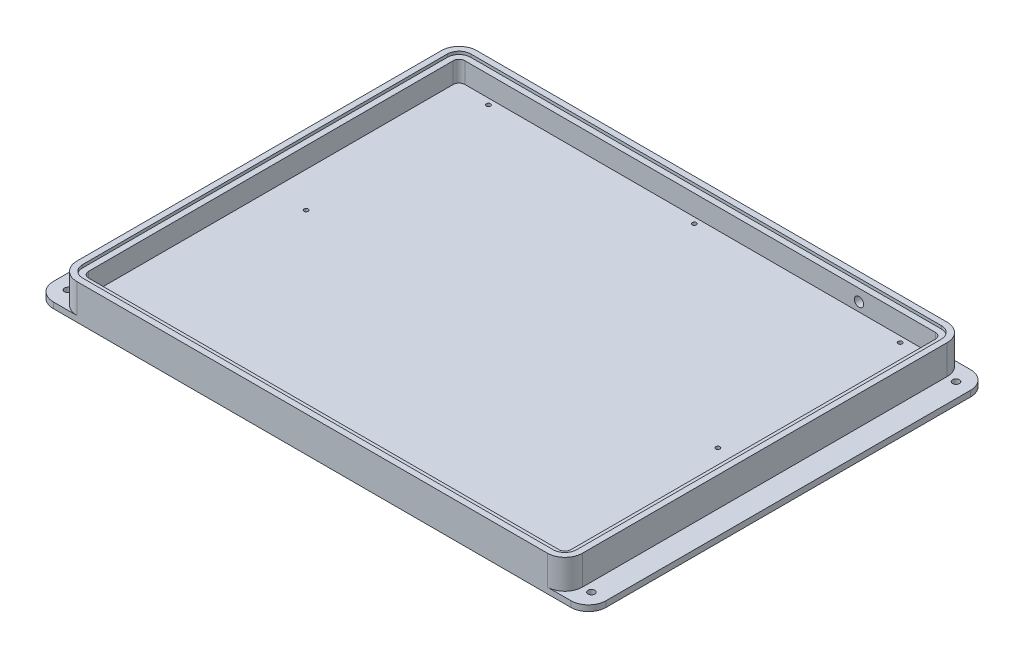
from build123d import *

# Parameters (mm, degrees)
SKETCH1_W           = 273.05
SKETCH1_H           = 215.9
BOSS_EXTRUDE1_DEPTH = 19.05
FILLET1_R           = 9.525
CUT_EXTRUDE1_DEPTH  = 12.7
CUT_EXTRUDE2_DEPTH  = 1.5875
SKETCH5_R           = 1.1303
CUT_EXTRUDE3_DEPTH  = 4.7625
SKETCH6_R           = 2.5
CUT_EXTRUDE4_DEPTH  = 12.7
BOSS_EXTRUDE2_DEPTH = 3.175
SKETCH8_R           = 1.8288
CUT_EXTRUDE5_DEPTH  = 359.493916441


with BuildPart() as part:
    # Sketch1 → Boss-Extrude1 (new body)
    with BuildSketch(Plane(origin=(0, 0, 0), x_dir=(1, 0, 0), z_dir=(0, 1, 0))):
        with Locations((136.525, 107.95)):
            Rectangle(SKETCH1_W, SKETCH1_H)
    extrude(amount=BOSS_EXTRUDE1_DEPTH)

    # Fillet1
    fillet1_edges = [part.edges().sort_by_distance(p)[0] for p in [
        (273.05, 9.525, 0),
        (273.05, 9.525, -215.9),
        (0, 9.525, 0),
        (0, 9.525, -215.9),
    ]]
    fillet(fillet1_edges, radius=FILLET1_R)

    # Sketch3 → Cut-Extrude1 (cut)
    with BuildSketch(Plane(origin=(0, 19.05, 0), x_dir=(1, 0, 0), z_dir=(0, 1, 0))):
        with BuildLine():
            Line((266.7, 9.525), (266.7, 206.375))
            ThreePointArc((266.7, 206.375), (265.77006403, 208.62006403), (263.525, 209.55))
            Line((263.525, 209.55), (9.525, 209.55))
            ThreePointArc((9.525, 209.55), (7.27993597, 208.62006403), (6.35, 206.375))
            Line((6.35, 206.375), (6.35, 9.525))
            ThreePointArc((6.35, 9.525), (7.27993597, 7.27993597), (9.525, 6.35))
            Line((9.525, 6.35), (263.525, 6.35))
            ThreePointArc((263.525, 6.35), (265.77006403, 7.27993597), (266.7, 9.525))
        make_face()
    extrude(amount=-CUT_EXTRUDE1_DEPTH, mode=Mode.SUBTRACT)

    # Sketch4 → Cut-Extrude2 (cut)
    with BuildSketch(Plane(origin=(0, 19.05, 0), x_dir=(1, 0, 0), z_dir=(0, 1, 0))):
        with BuildLine():
            Line((269.875, 9.525), (269.875, 206.375))
            ThreePointArc((269.875, 206.375), (268.015128061, 210.865128061), (263.525, 212.725))
            Line((263.525, 212.725), (9.525, 212.725))
            ThreePointArc((9.525, 212.725), (5.034871939, 210.865128061), (3.175, 206.375))
            Line((3.175, 206.375), (3.175, 9.525))
            ThreePointArc((3.175, 9.525), (5.034871939, 5.034871939), (9.525, 3.175))
            Line((9.525, 3.175), (263.525, 3.175))
            ThreePointArc((263.525, 3.175), (268.015128061, 5.034871939), (269.875, 9.525))
        make_face()
    extrude(amount=-CUT_EXTRUDE2_DEPTH, mode=Mode.SUBTRACT)

    # Sketch5 → Cut-Extrude3 (cut)
    with BuildSketch(Plane(origin=(0, 6.35, 0), x_dir=(1, 0, 0), z_dir=(0, 1, 0))):
        with Locations((25.4, 206.375)):
            Circle(SKETCH5_R)
        with Locations((136.525, 206.375)):
            Circle(SKETCH5_R)
        with Locations((247.65, 206.375)):
            Circle(SKETCH5_R)
        with Locations((247.65, 107.95)):
            Circle(SKETCH5_R)
        with Locations((25.4, 107.95)):
            Circle(SKETCH5_R)
        with Locations((25.4, 9.525)):
            Circle(SKETCH5_R)
        with Locations((136.525, 9.525)):
            Circle(SKETCH5_R)
        with Locations((247.65, 9.525)):
            Circle(SKETCH5_R)
    extrude(amount=-CUT_EXTRUDE3_DEPTH, mode=Mode.SUBTRACT)

    # Sketch6 → Cut-Extrude4 (cut)
    with BuildSketch(Plane(origin=(0, 0, -215.9), x_dir=(-1, 0, 0), z_dir=(0, 0, -1))):
        with Locations((-222.25, 11.1125)):
            Circle(SKETCH6_R)
    extrude(amount=-CUT_EXTRUDE4_DEPTH, mode=Mode.SUBTRACT)

    # Sketch7 → Boss-Extrude2 (add)
    with BuildSketch(Plane.XZ):
        with BuildLine():
            Line((-3.175, 0), (276.225, 0))
            ThreePointArc((276.225, 0), (282.960192091, -2.789807909), (285.75, -9.525))
            Line((285.75, -9.525), (285.75, -206.375))
            ThreePointArc((285.75, -206.375), (282.960192091, -213.110192091), (276.225, -215.9))
            Line((276.225, -215.9), (-3.175, -215.9))
            ThreePointArc((-3.175, -215.9), (-9.910192091, -213.110192091), (-12.7, -206.375))
            Line((-12.7, -206.375), (-12.7, -9.525))
            ThreePointArc((-12.7, -9.525), (-9.910192091, -2.789807909), (-3.175, 0))
        make_face()
    extrude(amount=-BOSS_EXTRUDE2_DEPTH)

    # Sketch8 → Cut-Extrude5 (cut, through all)
    with BuildSketch(Plane(origin=(0, 3.175, 0), x_dir=(1, 0, 0), z_dir=(0, 1, 0))):
        with Locations((-4.7625, 206.375)):
            Circle(SKETCH8_R)
        with Locations((-4.7625, 9.525)):
            Circle(SKETCH8_R)
        with Locations((277.8125, 9.525)):
            Circle(SKETCH8_R)
        with Locations((277.8125, 206.375)):
            Circle(SKETCH8_R)
    extrude(amount=-CUT_EXTRUDE5_DEPTH, mode=Mode.SUBTRACT)


solid = part.part
